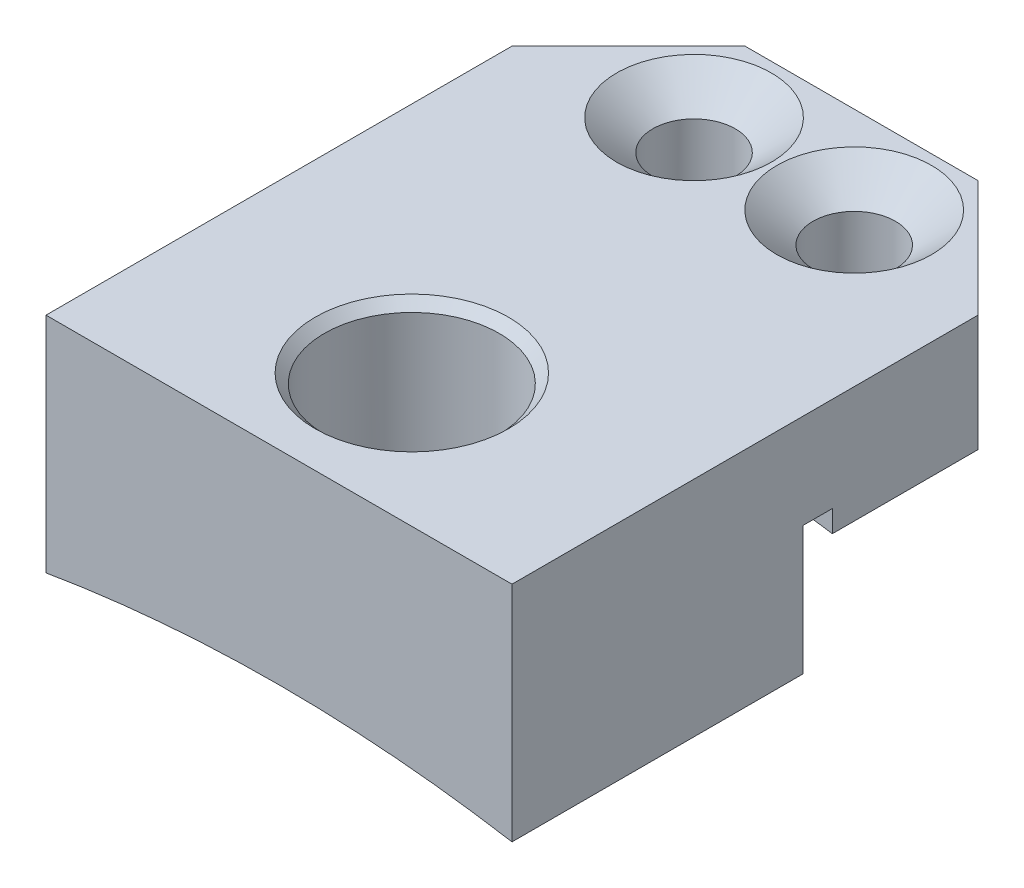
from build123d import *

# Parameters (mm, degrees)
SKETCH1_W                                         = 25.4
SKETCH1_H                                         = 31.75
BOSS_EXTRUDE1_DEPTH                               = 6.35
CUT_EXTRUDE1_DEPTH                                = 35.780382402
BOSS_EXTRUDE2_DEPTH                               = 15.875
SKETCH4_W                                         = 1.5875
SKETCH4_H                                         = 1.190625
CUT_EXTRUDE2_DEPTH                                = 31.618591166
CHAMFER1_SIZE                                     = 6.35
SKETCH5_R                                         = 1.524
CUT_EXTRUDE3_DEPTH                                = 24.692140063
CSK_FOR_8_FLAT_HEAD_MACHINE_SCREW_100_D           = 4.4958
CSK_FOR_8_FLAT_HEAD_MACHINE_SCREW_100_CSINK_D     = 8.4328
CSK_FOR_8_FLAT_HEAD_MACHINE_SCREW_100_CSINK_ANGLE = 100
SKETCH8_R                                         = 4.7625
CUT_EXTRUDE4_DEPTH                                = 24.692140235
CHAMFER2_SIZE                                     = 0.508


with BuildPart() as part:
    # Sketch1 → Boss-Extrude1 (new body)
    with BuildSketch(Plane(origin=(0, 0, 0), x_dir=(1, 0, 0), z_dir=(0, 1, 0))):
        Rectangle(SKETCH1_W, SKETCH1_H)
    extrude(amount=BOSS_EXTRUDE1_DEPTH)

    # Sketch2 → Cut-Extrude1 (cut, through all)
    with BuildSketch(Plane.XY.offset(15.875)):
        with BuildLine():
            Line((-12.7, 0), (12.7, 0))
            ThreePointArc((12.7, 0), (0, 0.990173613), (-12.7, 0))
        make_face()
    extrude(amount=-CUT_EXTRUDE1_DEPTH, mode=Mode.SUBTRACT)

    # Sketch3 → Boss-Extrude2 (add)
    with BuildSketch(Plane.XY.offset(15.875)):
        with BuildLine():
            Line((-12.7, 6.35), (12.7, 6.35))
            Line((12.7, 6.35), (12.7, -5.816013142))
            ThreePointArc((12.7, -5.816013142), (0, -4.750226387), (-12.7, -5.816013142))
            Line((-12.7, -5.816013142), (-12.7, 6.35))
        make_face()
    extrude(amount=-BOSS_EXTRUDE2_DEPTH)

    # Sketch4 → Cut-Extrude2 (cut, through all)
    with BuildSketch(Plane.ZY.offset(12.7)):
        with Locations((-0.79375, 0.5953125)):
            Rectangle(SKETCH4_W, SKETCH4_H)
    extrude(amount=-CUT_EXTRUDE2_DEPTH, mode=Mode.SUBTRACT)

    # Chamfer1
    chamfer1_edges = [part.edges().sort_by_distance(p)[0] for p in [
        (-12.7, 3.175, -15.875),
        (12.7, 3.175, -15.875),
    ]]
    chamfer(chamfer1_edges, length=CHAMFER1_SIZE)

    # Sketch5 → Cut-Extrude3 (cut, through all)
    with BuildSketch(Plane(origin=(0, 6.35, 0), x_dir=(1, 0, 0), z_dir=(0, 1, 0))):
        with Locations((0, -8.636)):
            Circle(SKETCH5_R)
    extrude(amount=-CUT_EXTRUDE3_DEPTH, mode=Mode.SUBTRACT)

    # CSK for #8 Flat Head Machine Screw (100)1 (through all)
    with Locations(Plane(origin=(0, 6.35, 0), x_dir=(1, 0, 0), z_dir=(0, 1, 0))):
        with Locations((-4.365625, 11.1125), (4.365625, 11.1125)):
            CounterSinkHole(CSK_FOR_8_FLAT_HEAD_MACHINE_SCREW_100_D / 2, CSK_FOR_8_FLAT_HEAD_MACHINE_SCREW_100_CSINK_D / 2, counter_sink_angle=CSK_FOR_8_FLAT_HEAD_MACHINE_SCREW_100_CSINK_ANGLE)

    # Sketch8 → Cut-Extrude4 (cut, through all)
    with BuildSketch(Plane(origin=(0, 6.35, 0), x_dir=(1, 0, 0), z_dir=(0, 1, 0))):
        with Locations((0, -8.636)):
            Circle(SKETCH8_R)
    extrude(amount=-CUT_EXTRUDE4_DEPTH, mode=Mode.SUBTRACT)

    # Chamfer2
    chamfer2_edges = [part.edges().sort_by_distance(p)[0] for p in [
        (-4.7625, 6.35, 8.636),
    ]]
    chamfer(chamfer2_edges, length=CHAMFER2_SIZE)


solid = part.part
